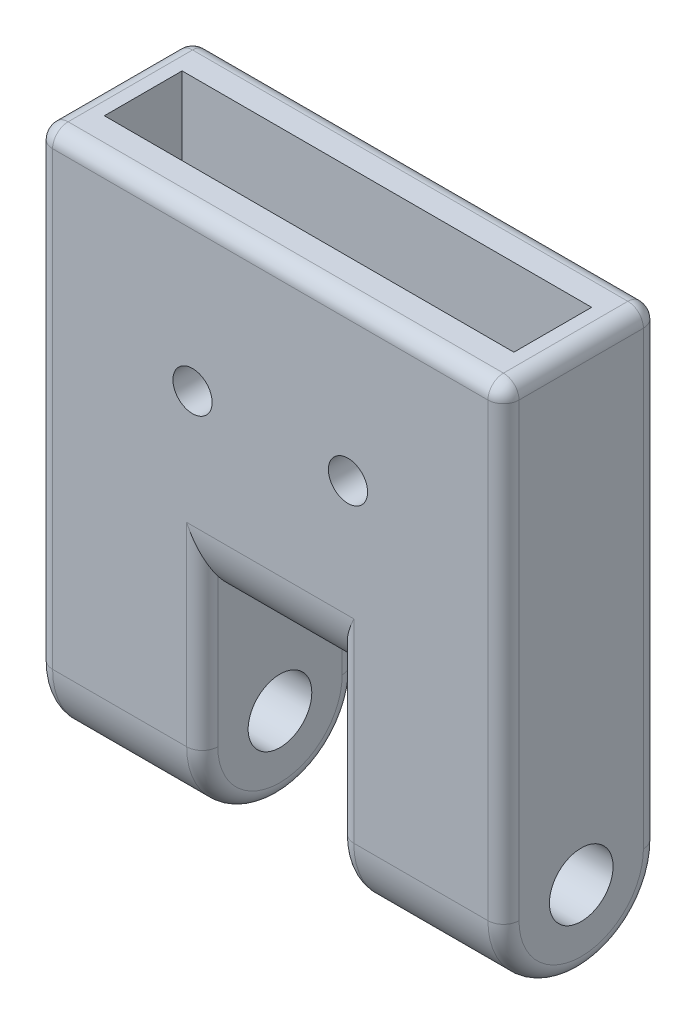
from build123d import *

# Parameters (mm, degrees)
ESQUISSE1_W             = 38.1
ESQUISSE1_H             = 12.7
BOSS_EXTRU_1_DEPTH      = 3.175
ESQUISSE2_W             = 38.1
ESQUISSE2_H             = 12.7
ESQUISSE2_W_2           = 33.4518
ESQUISSE2_H_2           = 6.35
BOSS_EXTRU_2_DEPTH      = 25.4
ESQUISSE3_R             = 1.6
ENL_V_MAT_EXTRU_1_DEPTH = 25.4
ESQUISSE4_R             = 2.6
BOSS_EXTRU_3_DEPTH      = 13.49375
CONG_1_R                = 6.35
CONG_2_R                = 1.27


with BuildPart() as part:
    # Esquisse1 → Boss.-Extru.1 (new body)
    with BuildSketch(Plane(origin=(0, 0, 0), x_dir=(1, 0, 0), z_dir=(0, 1, 0))):
        Rectangle(ESQUISSE1_W, ESQUISSE1_H)
    extrude(amount=BOSS_EXTRU_1_DEPTH)

    # Esquisse2 → Boss.-Extru.2 (add)
    with BuildSketch(Plane(origin=(0, 3.175, 0), x_dir=(1, 0, 0), z_dir=(0, 1, 0))):
        Rectangle(ESQUISSE2_W, ESQUISSE2_H)
        Rectangle(ESQUISSE2_W_2, ESQUISSE2_H_2, mode=Mode.SUBTRACT)
    extrude(amount=BOSS_EXTRU_2_DEPTH)

    # Esquisse3 → Enlèv. mat.-Extru.1 (cut)
    with BuildSketch(Plane.XY.offset(6.35)):
        with Locations((-6.35, 15.875)):
            Circle(ESQUISSE3_R)
        with Locations((6.35, 15.875)):
            Circle(ESQUISSE3_R)
    extrude(amount=-ENL_V_MAT_EXTRU_1_DEPTH, mode=Mode.SUBTRACT)

    # Esquisse4 → Boss.-Extru.3 (add)
    with BuildSketch(Plane(origin=(19.05, 0, 0), x_dir=(0, 0, -1), z_dir=(1, 0, 0))):
        with BuildLine():
            Line((-6.35, 0), (-6.35, -9.525))
            ThreePointArc((-6.35, -9.525), (0, -15.875), (6.35, -9.525))
            Line((6.35, -9.525), (6.35, 0))
            Line((6.35, 0), (-6.35, 0))
        make_face()
        with Locations((0, -9.525)):
            Circle(ESQUISSE4_R, mode=Mode.SUBTRACT)
    boss_extru_3 = extrude(amount=-BOSS_EXTRU_3_DEPTH)

    # Symétrie1: Boss.-Extru.3 across plane
    add(boss_extru_3.mirror(Plane(origin=(0, 0, 0), x_dir=(0, 0, 1), z_dir=(1, 0, 0))))

    # Congé1
    cong_1_edges = [part.edges().sort_by_distance(p)[0] for p in [
        (0, 0, -6.35),
        (0, 0, 6.35),
    ]]
    fillet(cong_1_edges, radius=CONG_1_R - 0.0001)  # a hair under: the kernel refuses the full size

    # Congé2
    cong_2_edges = [part.edges().sort_by_distance(p)[0] for p in [
        (-19.05, 28.575, 0),
        (0, 28.575, 6.35),
        (19.05, 28.575, 0),
        (0, 28.575, -6.35),
        (5.55625, -1.58755, -6.35),
        (5.55625, -15.875, 0),
        (5.55625, -1.58755, 6.35),
        (19.05, -15.875, 0),
        (-5.55625, -1.58755, 6.35),
        (-5.55625, -15.875, 0),
        (-5.55625, -1.58755, -6.35),
        (-19.05, -15.875, 0),
        (19.05, 9.525, 6.35),
        (-19.05, 9.525, 6.35),
        (-19.05, 9.525, -6.35),
        (19.05, 9.525, -6.35),
    ]]
    fillet(cong_2_edges, radius=CONG_2_R)


solid = part.part
